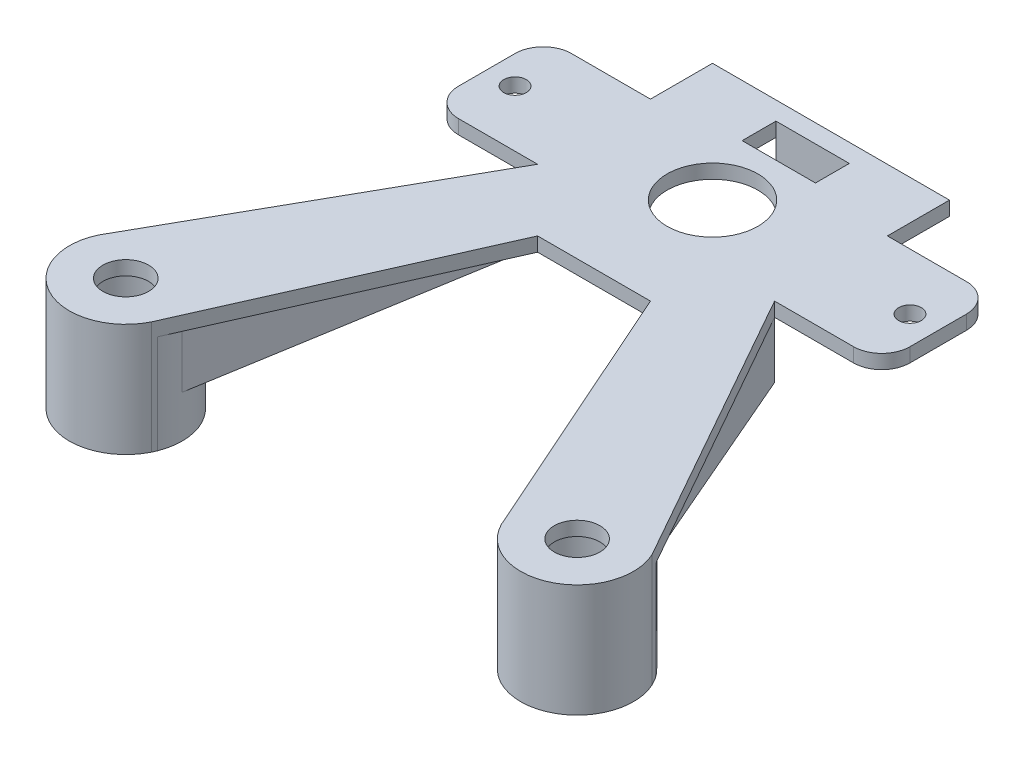
from build123d import *

# Parameters (mm, degrees)
SKETCH_6_W          = 42
SKETCH_6_H          = 42
SKETCH_6_R          = 8.05
EXTRUDE_1_DEPTH     = 2.5
SKETCH_7_R          = 4.05
EXTRUDE_5_DEPTH     = 2.5
SKETCH_7_7_R        = 4.05
EXTRUDE_7_DEPTH     = 20
SKETCH_7_8_R        = 4.05
EXTRUDE_8_DEPTH     = 20
EXTRUDE_9_DEPTH     = 10
SKETCH_9_R          = 7.6
CUT_EXTRUDE_1_DEPTH = 17.5
SKETCH_10_W         = 13
SKETCH_10_H         = 6
CUT_EXTRUDE_2_DEPTH = 17.5
SKETCH_11_W         = 13
SKETCH_11_H         = 3.25
EXTRUDE_10_DEPTH    = 5
SKETCH_12_R         = 1.05
CUT_EXTRUDE_3_DEPTH = 17.5
SKETCH_13_W         = 19
SKETCH_13_H         = 20
EXTRUDE_11_DEPTH    = 2.5
SKETCH_14_R         = 2
CUT_EXTRUDE_4_DEPTH = 2.5
FILLET_1_R          = 5


with BuildPart() as part:
    # 草图6 → 凸台-拉伸1 (new body)
    with BuildSketch(Plane(origin=(0, 0, 0), x_dir=(1, 0, 0), z_dir=(0, 1, 0))):
        Rectangle(SKETCH_6_W, SKETCH_6_H)
        Circle(SKETCH_6_R, mode=Mode.SUBTRACT)
    extrude(amount=EXTRUDE_1_DEPTH)

    # 草图7 → 凸台-拉伸5 (add)
    # profile 1 of 2: a face of its own
    with BuildSketch(Plane(origin=(0, 2.5, 0), x_dir=(1, 0, 0), z_dir=(0, 1, 0))):
        with BuildLine():
            Line((-10, -21), (-21, -21))
            Line((-21, -21), (-21, -10))
            Line((-21, -10), (-49.089190248, -59.830273313))
            ThreePointArc((-49.089190248, -59.830273313), (-44.301050518, -73.027788458), (-31.035510623, -68.431470434))
            Line((-31.035510623, -68.431470434), (-10, -21))
        make_face()
        with Locations((-40, -64)):
            Circle(SKETCH_7_R, mode=Mode.SUBTRACT)
    # profile 2 of 2: a face of its own
    with BuildSketch(Plane(origin=(0, 2.5, 0), x_dir=(1, 0, 0), z_dir=(0, 1, 0))):
        with BuildLine():
            Line((21, -10), (21, -21))
            Line((21, -21), (10, -21))
            Line((10, -21), (31.035510623, -68.431470434))
            ThreePointArc((31.035510623, -68.431470434), (44.301050518, -73.027788458), (49.089190248, -59.830273313))
            Line((49.089190248, -59.830273313), (21, -10))
        make_face()
        with Locations((40, -64)):
            Circle(SKETCH_7_R, mode=Mode.SUBTRACT)
    extrude(amount=-EXTRUDE_5_DEPTH)

    # 草图7<7> → 凸台-拉伸7 (add)
    with BuildSketch(Plane(origin=(0, 2.5, 0), x_dir=(1, 0, 0), z_dir=(0, 1, 0))):
        with BuildLine():
            Line((49.089190248, -59.830273313), (48.273152565, -58.382621018))
            ThreePointArc((48.273152565, -58.382621018), (35.328022799, -55.158471341), (30.697682143, -67.669725124))
            Line((30.697682143, -67.669725124), (31.035510623, -68.431470434))
            ThreePointArc((31.035510623, -68.431470434), (42.275423722, -73.737681802), (50, -64))
            ThreePointArc((50, -64), (49.769644376, -61.865978266), (49.089190248, -59.830273313))
        make_face()
        with Locations((40, -64)):
            Circle(SKETCH_7_7_R, mode=Mode.SUBTRACT)
    extrude(amount=-EXTRUDE_7_DEPTH)

    # 草图7<8> → 凸台-拉伸8 (add)
    with BuildSketch(Plane(origin=(0, 2.5, 0), x_dir=(1, 0, 0), z_dir=(0, 1, 0))):
        with BuildLine():
            Line((-31.035510623, -68.431470434), (-30.697682143, -67.669725124))
            ThreePointArc((-30.697682143, -67.669725124), (-30.175968786, -65.867728759), (-30, -64))
            ThreePointArc((-30, -64), (-37.061592749, -54.44145603), (-48.273152565, -58.382621018))
            Line((-48.273152565, -58.382621018), (-49.089190248, -59.830273313))
            ThreePointArc((-49.089190248, -59.830273313), (-44.301050518, -73.027788458), (-31.035510623, -68.431470434))
        make_face()
        with Locations((-40, -64)):
            Circle(SKETCH_7_8_R, mode=Mode.SUBTRACT)
    extrude(amount=-EXTRUDE_8_DEPTH)

    # 草图8 → 凸台-拉伸9 (add)
    with BuildSketch(Plane.XZ):
        with BuildLine():
            Line((40, 54), (21, 10))
            Line((21, 10), (30, 64))
            ThreePointArc((30, 64), (32.928932188, 56.928932188), (40, 54))
        make_face()
        with BuildLine():
            Line((-30, 64), (-21, 10))
            Line((-21, 10), (-40, 54))
            ThreePointArc((-40, 54), (-32.928932188, 56.928932188), (-30, 64))
        make_face()
    extrude(amount=EXTRUDE_9_DEPTH)

    # 草图9 → 切除-拉伸1 (cut)
    with BuildSketch(Plane.XZ.offset(17.5)):
        with Locations((-40, 64)):
            Circle(SKETCH_9_R)
        with Locations((40, 64)):
            Circle(SKETCH_9_R)
    extrude(amount=-CUT_EXTRUDE_1_DEPTH, mode=Mode.SUBTRACT)

    # 草图10 → 切除-拉伸2 (cut)
    with BuildSketch(Plane(origin=(0, 0, 0), x_dir=(-1, 0, 0), z_dir=(0, -1, 0))):
        with Locations((0, 14.75)):
            Rectangle(SKETCH_10_W, SKETCH_10_H)
    extrude(amount=-CUT_EXTRUDE_2_DEPTH, mode=Mode.SUBTRACT)

    # 草图11 → 凸台-拉伸10 (add)
    with BuildSketch(Plane.XZ):
        with Locations((0, -19.375)):
            Rectangle(SKETCH_11_W, SKETCH_11_H)
    extrude(amount=EXTRUDE_10_DEPTH)

    # 草图12 → 切除-拉伸3 (cut)
    with BuildSketch(Plane(origin=(0, 0, -21), x_dir=(-1, 0, 0), z_dir=(0, 0, -1))):
        with Locations((-3, -2.52)):
            Circle(SKETCH_12_R)
    extrude(amount=-CUT_EXTRUDE_3_DEPTH, mode=Mode.SUBTRACT)

    # 草图13 → 凸台-拉伸11 (add)
    with BuildSketch(Plane(origin=(0, 0, 0), x_dir=(1, 0, 0), z_dir=(0, 1, 0))):
        with Locations((30.5, 0)):
            Rectangle(SKETCH_13_W, SKETCH_13_H)
        with Locations((-30.5, 0)):
            Rectangle(SKETCH_13_W, SKETCH_13_H)
    extrude(amount=EXTRUDE_11_DEPTH)

    # 草图14 → 切除-拉伸4 (cut)
    with BuildSketch(Plane(origin=(0, 2.5, 0), x_dir=(1, 0, 0), z_dir=(0, 1, 0))):
        with Locations((35, 0)):
            Circle(SKETCH_14_R)
        with Locations((-35, 0)):
            Circle(SKETCH_14_R)
    extrude(amount=-CUT_EXTRUDE_4_DEPTH, mode=Mode.SUBTRACT)

    # 圆角1
    fillet_1_edges = [part.edges().sort_by_distance(p)[0] for p in [
        (-40, 1.25, -10),
        (-40, 1.25, 10),
        (40, 1.25, 10),
        (40, 1.25, -10),
    ]]
    fillet(fillet_1_edges, radius=FILLET_1_R)


solid = part.part
